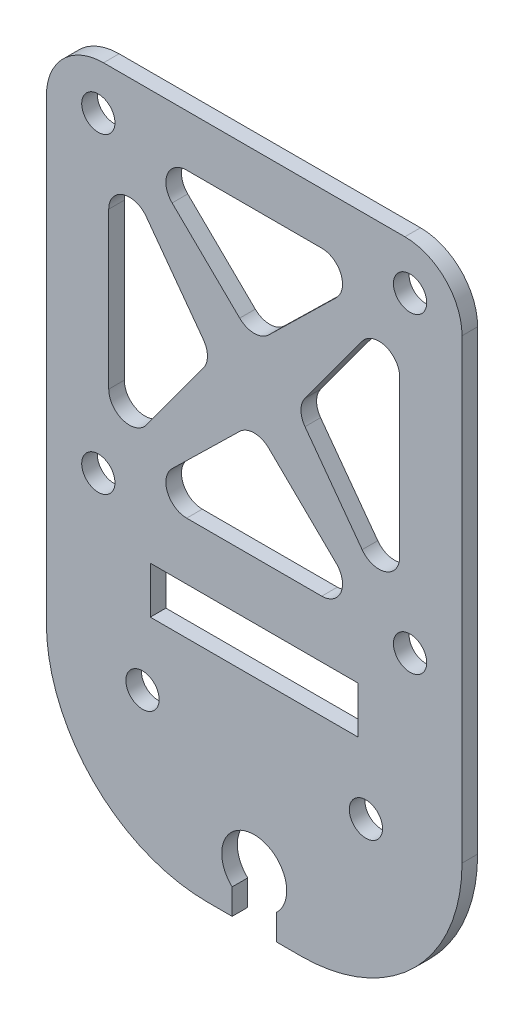
from build123d import *

# Parameters (mm, degrees)
SKETCH1_R           = 1.6
SKETCH1_W           = 20
SKETCH1_H           = 4.5
BOSS_EXTRUDE1_DEPTH = 0.75


with BuildPart() as part:
    # Sketch1 → Boss-Extrude1 (new, symmetric)
    with BuildSketch(Plane.XY):
        with BuildLine():
            Line((-20, 13.95), (-20, -30))
            ThreePointArc((-20, -30), (-15.460155108, -40.960155108), (-4.5, -45.5))
            Line((-4.5, -45.5), (-2.123950753, -45.5))
            Line((-2.123950753, -45.5), (-2.123950753, -43.0422605))
            ThreePointArc((-2.123950753, -43.0422605), (0, -37.625), (2.123950753, -43.0422605))
            Line((2.123950753, -43.0422605), (2.123950753, -45.5))
            Line((2.123950753, -45.5), (4.5, -45.5))
            ThreePointArc((4.5, -45.5), (15.460155108, -40.960155108), (20, -30))
            Line((20, -30), (20, 13.95))
            ThreePointArc((20, 13.95), (18.389087297, 17.839087297), (14.5, 19.45))
            Line((14.5, 19.45), (-14.5, 19.45))
            ThreePointArc((-14.5, 19.45), (-18.389087297, 17.839087297), (-20, 13.95))
        make_face()
        with Locations((-15, 15)):
            Circle(SKETCH1_R, mode=Mode.SUBTRACT)
        with Locations((15, 15)):
            Circle(SKETCH1_R, mode=Mode.SUBTRACT)
        with Locations((15, -15)):
            Circle(SKETCH1_R, mode=Mode.SUBTRACT)
        with Locations((-15, -15)):
            Circle(SKETCH1_R, mode=Mode.SUBTRACT)
        with Locations((10.75, -30.95)):
            Circle(SKETCH1_R, mode=Mode.SUBTRACT)
        with Locations((-10.75, -30.95)):
            Circle(SKETCH1_R, mode=Mode.SUBTRACT)
        with Locations((0, -22.25)):
            Rectangle(SKETCH1_W, SKETCH1_H, mode=Mode.SUBTRACT)
        with BuildLine():
            Line((-14, 7.5), (-14, -7.5))
            ThreePointArc((-14, -7.5), (-12.622245939, -9.400739328), (-10.387190008, -8.682727327))
            Line((-10.387190008, -8.682727327), (-4.887190008, -1.182727327))
            ThreePointArc((-4.887190008, -1.182727327), (-4.5, 0), (-4.887190008, 1.182727327))
            Line((-4.887190008, 1.182727327), (-10.387190008, 8.682727327))
            ThreePointArc((-10.387190008, 8.682727327), (-12.622245939, 9.400739328), (-14, 7.5))
        make_face(mode=Mode.SUBTRACT)
        with BuildLine():
            Line((4.887190008, 1.182727327), (10.387190008, 8.682727327))
            ThreePointArc((10.387190008, 8.682727327), (12.622245939, 9.400739328), (14, 7.5))
            Line((14, 7.5), (14, -7.5))
            ThreePointArc((14, -7.5), (12.622245939, -9.400739328), (10.387190008, -8.682727327))
            Line((10.387190008, -8.682727327), (4.887190008, -1.182727327))
            ThreePointArc((4.887190008, -1.182727327), (4.5, 0), (4.887190008, 1.182727327))
        make_face(mode=Mode.SUBTRACT)
        with BuildLine():
            Line((-7.897610015, 11.069375575), (-1.397610015, 4.719375575))
            ThreePointArc((-1.397610015, 4.719375575), (0, 4.15), (1.397610015, 4.719375575))
            Line((1.397610015, 4.719375575), (7.897610015, 11.069375575))
            ThreePointArc((7.897610015, 11.069375575), (8.352194489, 13.254569795), (6.5, 14.5))
            Line((6.5, 14.5), (-6.5, 14.5))
            ThreePointArc((-6.5, 14.5), (-8.352194489, 13.254569795), (-7.897610015, 11.069375575))
        make_face(mode=Mode.SUBTRACT)
        with BuildLine():
            Line((6.5, -14.5), (-6.5, -14.5))
            ThreePointArc((-6.5, -14.5), (-8.352194489, -13.254569795), (-7.897610015, -11.069375575))
            Line((-7.897610015, -11.069375575), (-1.397610015, -4.719375575))
            ThreePointArc((-1.397610015, -4.719375575), (0, -4.15), (1.397610015, -4.719375575))
            Line((1.397610015, -4.719375575), (7.897610015, -11.069375575))
            ThreePointArc((7.897610015, -11.069375575), (8.352194489, -13.254569795), (6.5, -14.5))
        make_face(mode=Mode.SUBTRACT)
    extrude(amount=BOSS_EXTRUDE1_DEPTH, both=True)


solid = part.part
